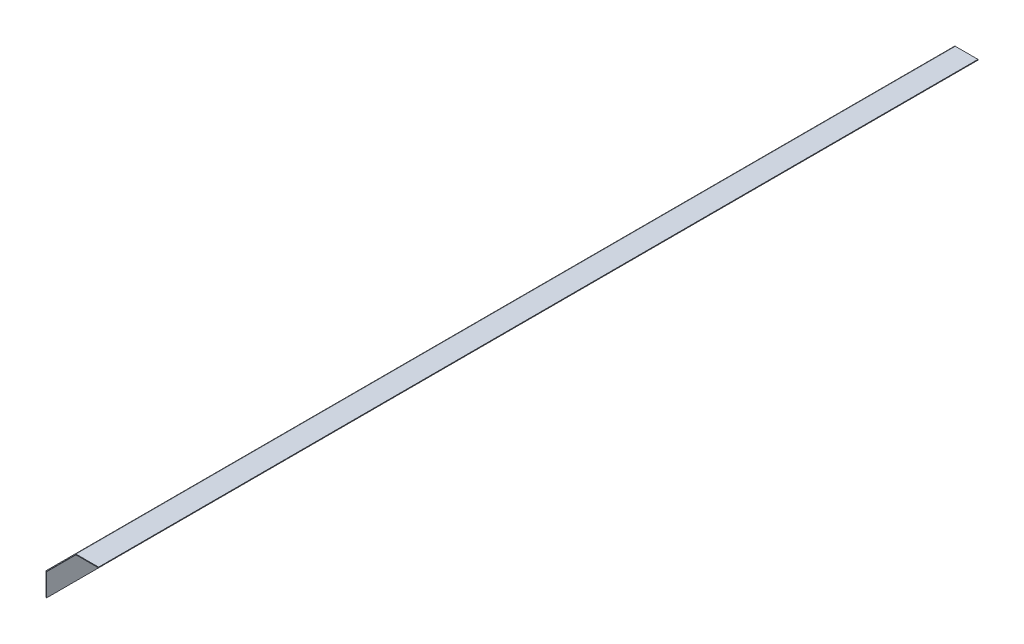
from build123d import *

# Parameters (mm, degrees)
BASE_FLANGE1_DEPTH = 950


# Sheet-metal steps are written as plain solids
with BuildPart() as part:
    # Sketch1 → Base-Flange1 (new body)
    with BuildSketch(Plane.XY):
        with BuildLine():
            Line((0, 0), (0, 24.38978058))
            ThreePointArc((0, 24.38978058), (0.112140673, 24.953549812), (0.43149029, 25.43149029))
            Line((0.43149029, 25.43149029), (31.388314863, 56.388314863))
            ThreePointArc((31.388314863, 56.388314863), (31.866255341, 56.707664481), (32.430024573, 56.819805153))
            Line((32.430024573, 56.819805153), (56.819805153, 56.819805153))
            Line((56.819805153, 56.819805153), (56.819805153, 56.083205153))
            Line((56.819805153, 56.083205153), (32.430024573, 56.083205153))
            ThreePointArc((32.430024573, 56.083205153), (32.148139957, 56.027134817), (31.909169718, 55.867460008))
            Line((31.909169718, 55.867460008), (0.952345145, 24.910635435))
            ThreePointArc((0.952345145, 24.910635435), (0.792670336, 24.671665196), (0.7366, 24.38978058))
            Line((0.7366, 24.38978058), (0.7366, 0))
            Line((0.7366, 0), (0, 0))
        make_face()
    extrude(amount=BASE_FLANGE1_DEPTH)


solid = part.part
